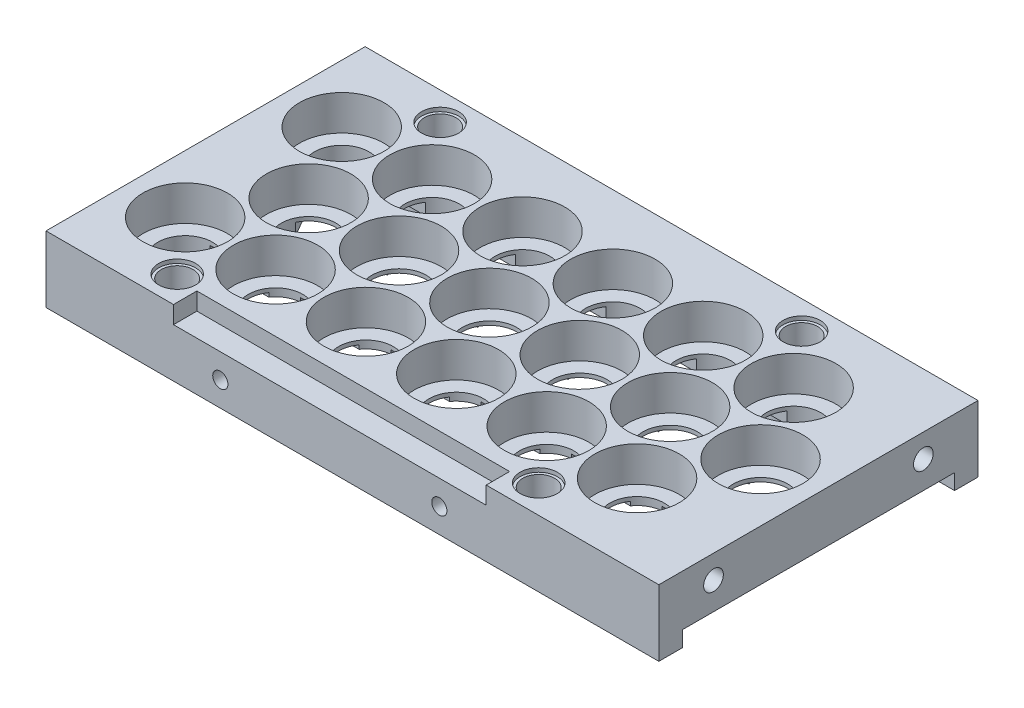
from build123d import *
from build123d.topology import SkipClean

# Parameters (mm, degrees)
SKETCH1_W            = 156.975
SKETCH1_H            = 81.746976195
SKETCH1_R            = 10.825
BOSS_EXTRUDE2_DEPTH  = 11
SKETCH1_3_R          = 10.825
SKETCH1_3_R_2        = 7
BOSS_EXTRUDE3_DEPTH  = 2
CUT_EXTRUDE1_DEPTH   = 1
CUT_EXTRUDE3_REACH   = 157.046
SKETCH9_R            = 4.0767
SKETCH10_R           = 4.7625
CUT_EXTRUDE4_DEPTH   = 1
SKETCH13_R           = 6.5
BOSS_EXTRUDE7_DEPTH  = 6
BOSS_EXTRUDE9_START  = 2
BOSS_EXTRUDE9_DEPTH  = 2
BOSS_EXTRUDE10_DEPTH = 2
SKETCH17_R           = 1.9431
CUT_EXTRUDE5_DEPTH   = 4
SKETCH19_W           = 80.1
SKETCH19_H           = 4.475
CUT_EXTRUDE6_DEPTH   = 6
SKETCH20_R           = 1.9431
CUT_EXTRUDE7_DEPTH   = 3.8862
SKETCH22_R           = 2.525
CUT_EXTRUDE8_DEPTH   = 3.81


with BuildPart() as part:
    # Sketch1 → Boss-Extrude2 (new body)
    with BuildSketch(Plane(origin=(0, 0, 0), x_dir=(1, 0, 0), z_dir=(0, 1, 0))):
        with Locations((63.6625, -20.048488098)):
            Rectangle(SKETCH1_W, SKETCH1_H)
        with Locations((0, -40.096976195)):
            Circle(SKETCH1_R, mode=Mode.SUBTRACT)
        with Locations((23.15, -40.096976195)):
            Circle(SKETCH1_R, mode=Mode.SUBTRACT)
        with Locations((46.3, -40.096976195)):
            Circle(SKETCH1_R, mode=Mode.SUBTRACT)
        with Locations((69.45, -40.096976195)):
            Circle(SKETCH1_R, mode=Mode.SUBTRACT)
        with Locations((92.6, -40.096976195)):
            Circle(SKETCH1_R, mode=Mode.SUBTRACT)
        with Locations((115.75, -40.096976195)):
            Circle(SKETCH1_R, mode=Mode.SUBTRACT)
        with Locations((11.575, -20.048488098)):
            Circle(SKETCH1_R, mode=Mode.SUBTRACT)
        Circle(SKETCH1_R, mode=Mode.SUBTRACT)
        with Locations((23.15, 0)):
            Circle(SKETCH1_R, mode=Mode.SUBTRACT)
        with Locations((34.725, -20.048488098)):
            Circle(SKETCH1_R, mode=Mode.SUBTRACT)
        with Locations((57.875, -20.048488098)):
            Circle(SKETCH1_R, mode=Mode.SUBTRACT)
        with Locations((46.3, 0)):
            Circle(SKETCH1_R, mode=Mode.SUBTRACT)
        with Locations((81.025, -20.048488098)):
            Circle(SKETCH1_R, mode=Mode.SUBTRACT)
        with Locations((69.45, 0)):
            Circle(SKETCH1_R, mode=Mode.SUBTRACT)
        with Locations((92.6, 0)):
            Circle(SKETCH1_R, mode=Mode.SUBTRACT)
        with Locations((104.175, -20.048488098)):
            Circle(SKETCH1_R, mode=Mode.SUBTRACT)
        with Locations((127.325, -20.048488098)):
            Circle(SKETCH1_R, mode=Mode.SUBTRACT)
        with Locations((115.75, 0)):
            Circle(SKETCH1_R, mode=Mode.SUBTRACT)
    extrude(amount=BOSS_EXTRUDE2_DEPTH)

    # Sketch1<3> → Boss-Extrude3 (add)
    # profile 1 of 18: a face of its own
    with BuildSketch(Plane(origin=(0, 0, 0), x_dir=(1, 0, 0), z_dir=(0, 1, 0))):
        Circle(SKETCH1_3_R)
        Circle(SKETCH1_3_R_2, mode=Mode.SUBTRACT)
    # profile 2 of 18: a face of its own
    with BuildSketch(Plane(origin=(0, 0, 0), x_dir=(1, 0, 0), z_dir=(0, 1, 0))):
        with Locations((11.575, -20.048488098)):
            Circle(SKETCH1_3_R)
        with Locations((11.575, -20.048488098)):
            Circle(SKETCH1_3_R_2, mode=Mode.SUBTRACT)
    # profile 3 of 18: a face of its own
    with BuildSketch(Plane(origin=(0, 0, 0), x_dir=(1, 0, 0), z_dir=(0, 1, 0))):
        with Locations((0, -40.096976195)):
            Circle(SKETCH1_3_R)
        with Locations((0, -40.096976195)):
            Circle(SKETCH1_3_R_2, mode=Mode.SUBTRACT)
    # profile 4 of 18: a face of its own
    with BuildSketch(Plane(origin=(0, 0, 0), x_dir=(1, 0, 0), z_dir=(0, 1, 0))):
        with Locations((23.15, 0)):
            Circle(SKETCH1_3_R)
        with Locations((23.15, 0)):
            Circle(SKETCH1_3_R_2, mode=Mode.SUBTRACT)
    # profile 5 of 18: a face of its own
    with BuildSketch(Plane(origin=(0, 0, 0), x_dir=(1, 0, 0), z_dir=(0, 1, 0))):
        with Locations((34.725, -20.048488098)):
            Circle(SKETCH1_3_R)
        with Locations((34.725, -20.048488098)):
            Circle(SKETCH1_3_R_2, mode=Mode.SUBTRACT)
    # profile 6 of 18: a face of its own
    with BuildSketch(Plane(origin=(0, 0, 0), x_dir=(1, 0, 0), z_dir=(0, 1, 0))):
        with Locations((23.15, -40.096976195)):
            Circle(SKETCH1_3_R)
        with Locations((23.15, -40.096976195)):
            Circle(SKETCH1_3_R_2, mode=Mode.SUBTRACT)
    # profile 7 of 18: a face of its own
    with BuildSketch(Plane(origin=(0, 0, 0), x_dir=(1, 0, 0), z_dir=(0, 1, 0))):
        with Locations((46.3, 0)):
            Circle(SKETCH1_3_R)
        with Locations((46.3, 0)):
            Circle(SKETCH1_3_R_2, mode=Mode.SUBTRACT)
    # profile 8 of 18: a face of its own
    with BuildSketch(Plane(origin=(0, 0, 0), x_dir=(1, 0, 0), z_dir=(0, 1, 0))):
        with Locations((57.875, -20.048488098)):
            Circle(SKETCH1_3_R)
        with Locations((57.875, -20.048488098)):
            Circle(SKETCH1_3_R_2, mode=Mode.SUBTRACT)
    # profile 9 of 18: a face of its own
    with BuildSketch(Plane(origin=(0, 0, 0), x_dir=(1, 0, 0), z_dir=(0, 1, 0))):
        with Locations((46.3, -40.096976195)):
            Circle(SKETCH1_3_R)
        with Locations((46.3, -40.096976195)):
            Circle(SKETCH1_3_R_2, mode=Mode.SUBTRACT)
    # profile 10 of 18: a face of its own
    with BuildSketch(Plane(origin=(0, 0, 0), x_dir=(1, 0, 0), z_dir=(0, 1, 0))):
        with Locations((69.45, 0)):
            Circle(SKETCH1_3_R)
        with Locations((69.45, 0)):
            Circle(SKETCH1_3_R_2, mode=Mode.SUBTRACT)
    # profile 11 of 18: a face of its own
    with BuildSketch(Plane(origin=(0, 0, 0), x_dir=(1, 0, 0), z_dir=(0, 1, 0))):
        with Locations((81.025, -20.048488098)):
            Circle(SKETCH1_3_R)
        with Locations((81.025, -20.048488098)):
            Circle(SKETCH1_3_R_2, mode=Mode.SUBTRACT)
    # profile 12 of 18: a face of its own
    with BuildSketch(Plane(origin=(0, 0, 0), x_dir=(1, 0, 0), z_dir=(0, 1, 0))):
        with Locations((69.45, -40.096976195)):
            Circle(SKETCH1_3_R)
        with Locations((69.45, -40.096976195)):
            Circle(SKETCH1_3_R_2, mode=Mode.SUBTRACT)
    # profile 13 of 18: a face of its own
    with BuildSketch(Plane(origin=(0, 0, 0), x_dir=(1, 0, 0), z_dir=(0, 1, 0))):
        with Locations((92.6, 0)):
            Circle(SKETCH1_3_R)
        with Locations((92.6, 0)):
            Circle(SKETCH1_3_R_2, mode=Mode.SUBTRACT)
    # profile 14 of 18: a face of its own
    with BuildSketch(Plane(origin=(0, 0, 0), x_dir=(1, 0, 0), z_dir=(0, 1, 0))):
        with Locations((104.175, -20.048488098)):
            Circle(SKETCH1_3_R)
        with Locations((104.175, -20.048488098)):
            Circle(SKETCH1_3_R_2, mode=Mode.SUBTRACT)
    # profile 15 of 18: a face of its own
    with BuildSketch(Plane(origin=(0, 0, 0), x_dir=(1, 0, 0), z_dir=(0, 1, 0))):
        with Locations((92.6, -40.096976195)):
            Circle(SKETCH1_3_R)
        with Locations((92.6, -40.096976195)):
            Circle(SKETCH1_3_R_2, mode=Mode.SUBTRACT)
    # profile 16 of 18: a face of its own
    with BuildSketch(Plane(origin=(0, 0, 0), x_dir=(1, 0, 0), z_dir=(0, 1, 0))):
        with Locations((115.75, 0)):
            Circle(SKETCH1_3_R)
        with Locations((115.75, 0)):
            Circle(SKETCH1_3_R_2, mode=Mode.SUBTRACT)
    # profile 17 of 18: a face of its own
    with BuildSketch(Plane(origin=(0, 0, 0), x_dir=(1, 0, 0), z_dir=(0, 1, 0))):
        with Locations((127.325, -20.048488098)):
            Circle(SKETCH1_3_R)
        with Locations((127.325, -20.048488098)):
            Circle(SKETCH1_3_R_2, mode=Mode.SUBTRACT)
    # profile 18 of 18: a face of its own
    with BuildSketch(Plane(origin=(0, 0, 0), x_dir=(1, 0, 0), z_dir=(0, 1, 0))):
        with Locations((115.75, -40.096976195)):
            Circle(SKETCH1_3_R)
        with Locations((115.75, -40.096976195)):
            Circle(SKETCH1_3_R_2, mode=Mode.SUBTRACT)
    extrude(amount=BOSS_EXTRUDE3_DEPTH)

    # Sketch2 → Cut-Extrude1 (cut)
    with BuildSketch(Plane.XZ):
        with BuildLine():
            Line((-0.591820292, 33.12203901), (5.238617062, 23.023425283))
            ThreePointArc((5.238617062, 23.023425283), (8.075, 26.110665924), (12.166820292, 27.023425283))
            Line((12.166820292, 27.023425283), (6.92820323, 36.096976195))
            Line((6.92820323, 36.096976195), (17.405437353, 36.096976195))
            ThreePointArc((17.405437353, 36.096976195), (16.15, 40.096976195), (17.405437353, 44.096976195))
            Line((17.405437353, 44.096976195), (5.744562647, 44.096976195))
            ThreePointArc((5.744562647, 44.096976195), (6.062177826, 36.596976195), (-0.591820292, 33.12203901))
        make_face()
        with BuildLine():
            Line((27.79679677, 24.048488098), (17.319562647, 24.048488098))
            ThreePointArc((17.319562647, 24.048488098), (18.575, 20.048488098), (17.319562647, 16.048488098))
            Line((17.319562647, 16.048488098), (27.79679677, 16.048488098))
            Line((27.79679677, 16.048488098), (22.558179708, 6.974937186))
            ThreePointArc((22.558179708, 6.974937186), (26.124937186, 6.336382938), (28.894562647, 4))
            Line((28.894562647, 4), (6.92820323, 4))
            Line((6.92820323, 4), (12.166820292, 13.073550912))
            ThreePointArc((12.166820292, 13.073550912), (8.075, 13.986310271), (5.238617062, 17.073550912))
            Line((5.238617062, 17.073550912), (-0.591820292, 6.974937186))
            ThreePointArc((-0.591820292, 6.974937186), (2.974937186, 6.336382938), (5.744562647, 4))
            Line((5.744562647, 4), (0, 4))
            ThreePointArc((0, 4), (-4, 0), (0, -4))
            Line((0, -4), (115.75, -4))
            ThreePointArc((115.75, -4), (119.75, 0), (115.75, 4))
            Line((115.75, 4), (99.52820323, 4))
            Line((99.52820323, 4), (104.766820292, 13.073550912))
            ThreePointArc((104.766820292, 13.073550912), (97.175, 20.048488098), (104.766820292, 27.023425283))
            Line((104.766820292, 27.023425283), (99.52820323, 36.096976195))
            Line((99.52820323, 36.096976195), (110.005437353, 36.096976195))
            ThreePointArc((110.005437353, 36.096976195), (108.75, 40.096976195), (110.005437353, 44.096976195))
            Line((110.005437353, 44.096976195), (98.344562647, 44.096976195))
            ThreePointArc((98.344562647, 44.096976195), (98.662177826, 36.596976195), (92.008179708, 33.12203901))
            Line((92.008179708, 33.12203901), (97.24679677, 24.048488098))
            Line((97.24679677, 24.048488098), (86.769562647, 24.048488098))
            ThreePointArc((86.769562647, 24.048488098), (88.025, 20.048488098), (86.769562647, 16.048488098))
            Line((86.769562647, 16.048488098), (97.24679677, 16.048488098))
            Line((97.24679677, 16.048488098), (92.008179708, 6.974937186))
            ThreePointArc((92.008179708, 6.974937186), (95.574937186, 6.336382938), (98.344562647, 4))
            Line((98.344562647, 4), (76.37820323, 4))
            Line((76.37820323, 4), (81.616820292, 13.073550912))
            ThreePointArc((81.616820292, 13.073550912), (74.025, 20.048488098), (81.616820292, 27.023425283))
            Line((81.616820292, 27.023425283), (76.37820323, 36.096976195))
            Line((76.37820323, 36.096976195), (86.855437353, 36.096976195))
            ThreePointArc((86.855437353, 36.096976195), (85.6, 40.096976195), (86.855437353, 44.096976195))
            Line((86.855437353, 44.096976195), (75.194562647, 44.096976195))
            ThreePointArc((75.194562647, 44.096976195), (75.512177826, 36.596976195), (68.858179708, 33.12203901))
            Line((68.858179708, 33.12203901), (74.09679677, 24.048488098))
            Line((74.09679677, 24.048488098), (63.619562647, 24.048488098))
            ThreePointArc((63.619562647, 24.048488098), (64.875, 20.048488098), (63.619562647, 16.048488098))
            Line((63.619562647, 16.048488098), (74.09679677, 16.048488098))
            Line((74.09679677, 16.048488098), (68.858179708, 6.974937186))
            ThreePointArc((68.858179708, 6.974937186), (72.424937186, 6.336382938), (75.194562647, 4))
            Line((75.194562647, 4), (53.22820323, 4))
            Line((53.22820323, 4), (58.466820292, 13.073550912))
            ThreePointArc((58.466820292, 13.073550912), (50.875, 20.048488098), (58.466820292, 27.023425283))
            Line((58.466820292, 27.023425283), (53.22820323, 36.096976195))
            Line((53.22820323, 36.096976195), (63.705437353, 36.096976195))
            ThreePointArc((63.705437353, 36.096976195), (62.45, 40.096976195), (63.705437353, 44.096976195))
            Line((63.705437353, 44.096976195), (52.044562647, 44.096976195))
            ThreePointArc((52.044562647, 44.096976195), (52.362177826, 36.596976195), (45.708179708, 33.12203901))
            Line((45.708179708, 33.12203901), (50.94679677, 24.048488098))
            Line((50.94679677, 24.048488098), (40.469562647, 24.048488098))
            ThreePointArc((40.469562647, 24.048488098), (41.725, 20.048488098), (40.469562647, 16.048488098))
            Line((40.469562647, 16.048488098), (50.94679677, 16.048488098))
            Line((50.94679677, 16.048488098), (45.708179708, 6.974937186))
            ThreePointArc((45.708179708, 6.974937186), (49.274937186, 6.336382938), (52.044562647, 4))
            Line((52.044562647, 4), (30.07820323, 4))
            Line((30.07820323, 4), (35.316820292, 13.073550912))
            ThreePointArc((35.316820292, 13.073550912), (27.725, 20.048488098), (35.316820292, 27.023425283))
            Line((35.316820292, 27.023425283), (30.07820323, 36.096976195))
            Line((30.07820323, 36.096976195), (40.555437353, 36.096976195))
            ThreePointArc((40.555437353, 36.096976195), (39.3, 40.096976195), (40.555437353, 44.096976195))
            Line((40.555437353, 44.096976195), (28.894562647, 44.096976195))
            ThreePointArc((28.894562647, 44.096976195), (29.212177826, 36.596976195), (22.558179708, 33.12203901))
            Line((22.558179708, 33.12203901), (27.79679677, 24.048488098))
        make_face()
        with BuildLine():
            Line((127.916820292, 27.023425283), (122.086382938, 37.12203901))
            ThreePointArc((122.086382938, 37.12203901), (119.25, 34.034798369), (115.158179708, 33.12203901))
            Line((115.158179708, 33.12203901), (120.39679677, 24.048488098))
            Line((120.39679677, 24.048488098), (109.919562647, 24.048488098))
            ThreePointArc((109.919562647, 24.048488098), (111.175, 20.048488098), (109.919562647, 16.048488098))
            Line((109.919562647, 16.048488098), (120.39679677, 16.048488098))
            Line((120.39679677, 16.048488098), (115.158179708, 6.974937186))
            ThreePointArc((115.158179708, 6.974937186), (119.25, 6.062177826), (122.086382938, 2.974937186))
            Line((122.086382938, 2.974937186), (127.916820292, 13.073550912))
            ThreePointArc((127.916820292, 13.073550912), (120.325, 20.048488098), (127.916820292, 27.023425283))
        make_face()
    extrude(amount=-CUT_EXTRUDE1_DEPTH, mode=Mode.SUBTRACT)

    # Sketch9 → Cut-Extrude3 (cut, up to next)
    with BuildSketch(Plane(origin=(0, 11, 0), x_dir=(1, 0, 0), z_dir=(0, 1, 0)), mode=Mode.PRIVATE) as cut_extrude3_sk1:
        with Locations((11.575, 13.625)):
            Circle(SKETCH9_R)
    cut_extrude3_tool1 = extrude(cut_extrude3_sk1.sketch, amount=-CUT_EXTRUDE3_REACH, mode=Mode.PRIVATE) & part.part
    # Sketch9 → Cut-Extrude3 (cut, up to next)
    with BuildSketch(Plane(origin=(0, 11, 0), x_dir=(1, 0, 0), z_dir=(0, 1, 0)), mode=Mode.PRIVATE) as cut_extrude3_sk2:
        with Locations((11.575, -53.721976195)):
            Circle(SKETCH9_R)
    cut_extrude3_tool2 = extrude(cut_extrude3_sk2.sketch, amount=-CUT_EXTRUDE3_REACH, mode=Mode.PRIVATE) & part.part
    # Sketch9 → Cut-Extrude3 (cut, up to next)
    with BuildSketch(Plane(origin=(0, 11, 0), x_dir=(1, 0, 0), z_dir=(0, 1, 0)), mode=Mode.PRIVATE) as cut_extrude3_sk3:
        with Locations((104.175, -53.721976195)):
            Circle(SKETCH9_R)
    cut_extrude3_tool3 = extrude(cut_extrude3_sk3.sketch, amount=-CUT_EXTRUDE3_REACH, mode=Mode.PRIVATE) & part.part
    # Sketch9 → Cut-Extrude3 (cut, up to next)
    with BuildSketch(Plane(origin=(0, 11, 0), x_dir=(1, 0, 0), z_dir=(0, 1, 0)), mode=Mode.PRIVATE) as cut_extrude3_sk4:
        with Locations((104.175, 13.625)):
            Circle(SKETCH9_R)
    cut_extrude3_tool4 = extrude(cut_extrude3_sk4.sketch, amount=-CUT_EXTRUDE3_REACH, mode=Mode.PRIVATE) & part.part
    add(cut_extrude3_tool1.solids().sort_by_distance((11.575, 11, -13.625))[0], mode=Mode.SUBTRACT)
    add(cut_extrude3_tool2.solids().sort_by_distance((11.575, 11, 53.721976))[0], mode=Mode.SUBTRACT)
    add(cut_extrude3_tool3.solids().sort_by_distance((104.175, 11, 53.721976))[0], mode=Mode.SUBTRACT)
    add(cut_extrude3_tool4.solids().sort_by_distance((104.175, 11, -13.625))[0], mode=Mode.SUBTRACT)

    # Sketch10 → Cut-Extrude4 (cut)
    with BuildSketch(Plane(origin=(0, 11, 0), x_dir=(1, 0, 0), z_dir=(0, 1, 0))):
        with Locations((11.575, 13.625)):
            Circle(SKETCH10_R)
        with Locations((104.175, 13.625)):
            Circle(SKETCH10_R)
        with Locations((104.175, -53.721976195)):
            Circle(SKETCH10_R)
        with Locations((11.575, -53.721976195)):
            Circle(SKETCH10_R)
    extrude(amount=-CUT_EXTRUDE4_DEPTH, mode=Mode.SUBTRACT)

    # Sketch13 → Boss-Extrude7 (add)
    # profile 1 of 2: a face of its own
    with BuildSketch(Plane.XZ):
        with BuildLine():
            ThreePointArc((3.665512027, 54.921976195), (11.575, 45.721976195), (19.484487973, 54.921976195))
            Line((19.484487973, 54.921976195), (96.265512027, 54.921976195))
            ThreePointArc((96.265512027, 54.921976195), (104.175, 45.721976195), (112.084487973, 54.921976195))
            Line((112.084487973, 54.921976195), (142.15, 54.921976195))
            Line((142.15, 54.921976195), (142.15, 60.921976195))
            Line((142.15, 60.921976195), (-14.825, 60.921976195))
            Line((-14.825, 60.921976195), (-14.825, 54.921976195))
            Line((-14.825, 54.921976195), (3.665512027, 54.921976195))
        make_face()
        with Locations((11.575, 53.721976195)):
            Circle(SKETCH13_R, mode=Mode.SUBTRACT)
        with Locations((104.175, 53.721976195)):
            Circle(SKETCH13_R, mode=Mode.SUBTRACT)
    # profile 2 of 2: a face of its own
    with BuildSketch(Plane.XZ):
        with BuildLine():
            Line((-14.825, -14.825), (-14.825, -20.825))
            Line((-14.825, -20.825), (142.15, -20.825))
            Line((142.15, -20.825), (142.15, -14.825))
            Line((142.15, -14.825), (112.084487973, -14.825))
            ThreePointArc((112.084487973, -14.825), (104.175, -5.625), (96.265512027, -14.825))
            Line((96.265512027, -14.825), (19.484487973, -14.825))
            ThreePointArc((19.484487973, -14.825), (11.575, -5.625), (3.665512027, -14.825))
            Line((3.665512027, -14.825), (-14.825, -14.825))
        make_face()
        with Locations((11.575, -13.625)):
            Circle(SKETCH13_R, mode=Mode.SUBTRACT)
        with Locations((104.175, -13.625)):
            Circle(SKETCH13_R, mode=Mode.SUBTRACT)
    extrude(amount=BOSS_EXTRUDE7_DEPTH)

    # Sketch14 → Boss-Extrude9 (add)
    with SkipClean():  # the faces are left unmerged after this step: merging them gives an invalid solid
        with BuildSketch(Plane.XZ.offset(BOSS_EXTRUDE9_START)):
            with BuildLine():
                Line((142.15, 54.921976195), (142.15, -14.825))
                Line((142.15, -14.825), (112.084487973, -14.825))
                ThreePointArc((112.084487973, -14.825), (104.175, -5.625), (96.265512027, -14.825))
                Line((96.265512027, -14.825), (19.484487973, -14.825))
                ThreePointArc((19.484487973, -14.825), (11.575, -5.625), (3.665512027, -14.825))
                Line((3.665512027, -14.825), (-14.825, -14.825))
                Line((-14.825, -14.825), (-14.825, 54.921976195))
                Line((-14.825, 54.921976195), (3.665512027, 54.921976195))
                ThreePointArc((3.665512027, 54.921976195), (11.575, 45.721976195), (19.484487973, 54.921976195))
                Line((19.484487973, 54.921976195), (96.265512027, 54.921976195))
                ThreePointArc((96.265512027, 54.921976195), (104.175, 45.721976195), (112.084487973, 54.921976195))
                Line((112.084487973, 54.921976195), (142.15, 54.921976195))
            make_face()
            with BuildLine():
                Line((5.238617062, 17.073550912), (-0.591820292, 6.974937186))
                ThreePointArc((-0.591820292, 6.974937186), (-6.062177826, -3.5), (5.744562647, -4))
                Line((5.744562647, -4), (17.405437353, -4))
                ThreePointArc((17.405437353, -4), (23.15, -7), (28.894562647, -4))
                Line((28.894562647, -4), (40.555437353, -4))
                ThreePointArc((40.555437353, -4), (46.3, -7), (52.044562647, -4))
                Line((52.044562647, -4), (63.705437353, -4))
                ThreePointArc((63.705437353, -4), (69.45, -7), (75.194562647, -4))
                Line((75.194562647, -4), (86.855437353, -4))
                ThreePointArc((86.855437353, -4), (92.6, -7), (98.344562647, -4))
                Line((98.344562647, -4), (110.005437353, -4))
                ThreePointArc((110.005437353, -4), (119.25, -6.062177826), (122.086382938, 2.974937186))
                Line((122.086382938, 2.974937186), (127.916820292, 13.073550912))
                ThreePointArc((127.916820292, 13.073550912), (134.325, 20.048488098), (127.916820292, 27.023425283))
                Line((127.916820292, 27.023425283), (122.086382938, 37.12203901))
                ThreePointArc((122.086382938, 37.12203901), (119.25, 46.159154022), (110.005437353, 44.096976195))
                Line((110.005437353, 44.096976195), (98.344562647, 44.096976195))
                ThreePointArc((98.344562647, 44.096976195), (92.6, 47.096976195), (86.855437353, 44.096976195))
                Line((86.855437353, 44.096976195), (75.194562647, 44.096976195))
                ThreePointArc((75.194562647, 44.096976195), (69.45, 47.096976195), (63.705437353, 44.096976195))
                Line((63.705437353, 44.096976195), (52.044562647, 44.096976195))
                ThreePointArc((52.044562647, 44.096976195), (46.3, 47.096976195), (40.555437353, 44.096976195))
                Line((40.555437353, 44.096976195), (28.894562647, 44.096976195))
                ThreePointArc((28.894562647, 44.096976195), (23.15, 47.096976195), (17.405437353, 44.096976195))
                Line((17.405437353, 44.096976195), (5.744562647, 44.096976195))
                ThreePointArc((5.744562647, 44.096976195), (-6.062177826, 43.596976195), (-0.591820292, 33.12203901))
                Line((-0.591820292, 33.12203901), (5.238617062, 23.023425283))
                ThreePointArc((5.238617062, 23.023425283), (4.575, 20.048488098), (5.238617062, 17.073550912))
            make_face(mode=Mode.SUBTRACT)
        extrude(amount=-BOSS_EXTRUDE9_DEPTH)

    # Sketch16 → Boss-Extrude10 (add)
    with SkipClean():  # the faces are left unmerged after this step: merging them gives an invalid solid
        with BuildSketch(Plane.XZ):
            with BuildLine():
                Line((15.536128823, 32.859238845), (20.688871177, 29.884301659))
                ThreePointArc((20.688871177, 29.884301659), (21.237909283, 27.835263554), (19.188871177, 27.286225448))
                Line((19.188871177, 27.286225448), (14.036128823, 30.261162634))
                ThreePointArc((14.036128823, 30.261162634), (13.487090717, 32.310200739), (15.536128823, 32.859238845))
            make_face()
            with BuildLine():
                Line((38.686128823, 32.859238845), (43.838871177, 29.884301659))
                ThreePointArc((43.838871177, 29.884301659), (44.387909283, 27.835263554), (42.338871177, 27.286225448))
                Line((42.338871177, 27.286225448), (37.186128823, 30.261162634))
                ThreePointArc((37.186128823, 30.261162634), (36.637090717, 32.310200739), (38.686128823, 32.859238845))
            make_face()
            with BuildLine():
                Line((61.836128823, 32.859238845), (66.988871177, 29.884301659))
                ThreePointArc((66.988871177, 29.884301659), (67.537909283, 27.835263554), (65.488871177, 27.286225448))
                Line((65.488871177, 27.286225448), (60.336128823, 30.261162634))
                ThreePointArc((60.336128823, 30.261162634), (59.787090717, 32.310200739), (61.836128823, 32.859238845))
            make_face()
            with BuildLine():
                Line((84.986128823, 32.859238845), (90.138871177, 29.884301659))
                ThreePointArc((90.138871177, 29.884301659), (90.687909283, 27.835263554), (88.638871177, 27.286225448))
                Line((88.638871177, 27.286225448), (83.486128823, 30.261162634))
                ThreePointArc((83.486128823, 30.261162634), (82.937090717, 32.310200739), (84.986128823, 32.859238845))
            make_face()
            with BuildLine():
                Line((108.136128823, 32.859238845), (113.288871177, 29.884301659))
                ThreePointArc((113.288871177, 29.884301659), (113.837909283, 27.835263554), (111.788871177, 27.286225448))
                Line((111.788871177, 27.286225448), (106.636128823, 30.261162634))
                ThreePointArc((106.636128823, 30.261162634), (106.087090717, 32.310200739), (108.136128823, 32.859238845))
            make_face()
            with BuildLine():
                Line((15.536128823, 7.23773735), (20.688871177, 10.212674536))
                ThreePointArc((20.688871177, 10.212674536), (21.237909283, 12.261712642), (19.188871177, 12.810750747))
                Line((19.188871177, 12.810750747), (14.036128823, 9.835813562))
                ThreePointArc((14.036128823, 9.835813562), (13.487090717, 7.786775456), (15.536128823, 7.23773735))
            make_face()
            with BuildLine():
                Line((38.686128823, 7.23773735), (43.838871177, 10.212674536))
                ThreePointArc((43.838871177, 10.212674536), (44.387909283, 12.261712642), (42.338871177, 12.810750747))
                Line((42.338871177, 12.810750747), (37.186128823, 9.835813562))
                ThreePointArc((37.186128823, 9.835813562), (36.637090717, 7.786775456), (38.686128823, 7.23773735))
            make_face()
            with BuildLine():
                Line((61.836128823, 7.23773735), (66.988871177, 10.212674536))
                ThreePointArc((66.988871177, 10.212674536), (67.537909283, 12.261712642), (65.488871177, 12.810750747))
                Line((65.488871177, 12.810750747), (60.336128823, 9.835813562))
                ThreePointArc((60.336128823, 9.835813562), (59.787090717, 7.786775456), (61.836128823, 7.23773735))
            make_face()
            with BuildLine():
                Line((84.986128823, 7.23773735), (90.138871177, 10.212674536))
                ThreePointArc((90.138871177, 10.212674536), (90.687909283, 12.261712642), (88.638871177, 12.810750747))
                Line((88.638871177, 12.810750747), (83.486128823, 9.835813562))
                ThreePointArc((83.486128823, 9.835813562), (82.937090717, 7.786775456), (84.986128823, 7.23773735))
            make_face()
            with BuildLine():
                Line((108.136128823, 7.23773735), (113.288871177, 10.212674536))
                ThreePointArc((113.288871177, 10.212674536), (113.837909283, 12.261712642), (111.788871177, 12.810750747))
                Line((111.788871177, 12.810750747), (106.636128823, 9.835813562))
                ThreePointArc((106.636128823, 9.835813562), (106.087090717, 7.786775456), (108.136128823, 7.23773735))
            make_face()
        extrude(amount=BOSS_EXTRUDE10_DEPTH)

    # Sketch17 → Cut-Extrude5 (cut)
    with BuildSketch(Plane(origin=(0, -2, 0), x_dir=(-1, 0, 0), z_dir=(0, -1, 0))):
        with Locations((8.825, -49.509476195)):
            Circle(SKETCH17_R)
        with Locations((-57.875, -49.509476195)):
            Circle(SKETCH17_R)
        with Locations((-132.15, -49.509476195)):
            Circle(SKETCH17_R)
        with Locations((-132.15, 9.4125)):
            Circle(SKETCH17_R)
        with Locations((-57.875, 9.4125)):
            Circle(SKETCH17_R)
        with Locations((8.825, 9.4125)):
            Circle(SKETCH17_R)
    extrude(amount=-CUT_EXTRUDE5_DEPTH, mode=Mode.SUBTRACT)

    # Sketch19 → Cut-Extrude6 (cut)
    with BuildSketch(Plane.XY.offset(60.921976195)):
        with Locations((57.875, 8.7625)):
            Rectangle(SKETCH19_W, SKETCH19_H)
    extrude(amount=-CUT_EXTRUDE6_DEPTH, mode=Mode.SUBTRACT)

    # Sketch20 → Cut-Extrude7 (cut)
    with BuildSketch(Plane.XY.offset(60.921976195)):
        with Locations((29.825, 0.2625)):
            Circle(SKETCH20_R)
        with Locations((85.925, 0.2625)):
            Circle(SKETCH20_R)
    extrude(amount=-CUT_EXTRUDE7_DEPTH, mode=Mode.SUBTRACT)

    # Sketch22 → Cut-Extrude8 (cut)
    with BuildSketch(Plane(origin=(142.15, 0, 0), x_dir=(0, 0, -1), z_dir=(1, 0, 0))):
        with Locations((-46.921976195, 5)):
            Circle(SKETCH22_R)
        with Locations((6.825, 5)):
            Circle(SKETCH22_R)
    extrude(amount=-CUT_EXTRUDE8_DEPTH, mode=Mode.SUBTRACT)


solid = part.part
